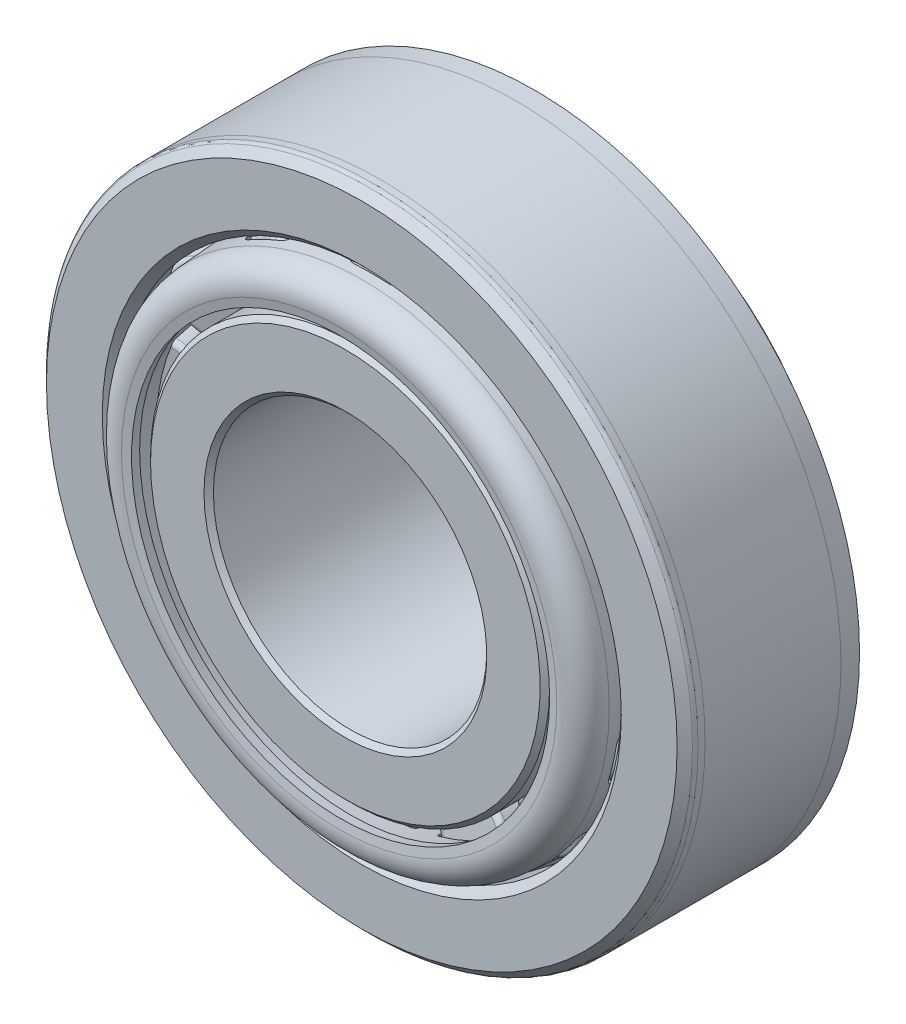
from build123d import *
from OCP.BRepFilletAPI import BRepFilletAPI_MakeChamfer

# Parameters (mm, degrees)
SKETCH8_R                 = 1.405
CUT_EXTRUDE1_DEPTH        = 0.635
FILLET7_R                 = 0.9525
CHAMFER4_SIZE             = 0.35125
CHAMFER4_SIZE2            = 0.341782835
FILLET8_R                 = 0.375
CIRPATTERN1_COUNT         = 14
FILLET9_R                 = 1.765
FILLET10_R                = 0.22425
FILLET11_R                = 0.25
CIRPATTERN2_COUNT         = 14
FILLET11_OF_CIRPATTERN2_R = 0.25
CHAMFER1_SIZE             = 0.648359375
CHAMFER1_SIZE2            = 0.551087377
FILLET6_R                 = 0.389015625
CHAMFER2_SIZE             = 0.3285
CHAMFER3_SIZE             = 0.6095


with BuildPart() as part:
    # Sketch2 → Revolve1 (revolve)
    with BuildSketch(Plane(origin=(0, 0, 0), x_dir=(0, 0, -1), z_dir=(1, 0, 0)), mode=Mode.PRIVATE) as revolve1_sk:
        Polygon((-6.0325, 22.621875), (-6.0325, 17.435), (6.0325, 19.845), (6.0325, 22.621875), align=None)
    revolve(revolve1_sk.sketch.rotate(Axis((0, 0, 0), (0, 0, -1)), 90), axis=Axis((0, 0, 0), (0, 0, -1)))

    # Chamfer1: one chamfer whose edges measure the first distance from different faces: ONE call of the kernel's chamfer builder (chamfer() names one face for all edges)
    chamfer1_edges_1 = [part.edges().sort_by_distance(p)[0] for p in [
        (-17.435, 0, 6.0325),
    ]]
    chamfer1_side_1 = [part.faces().sort_by_distance(p)[0] for p in [
        (-21.982031751, 0, 6.0325),
    ]]
    chamfer1_edges_2 = [part.edges().sort_by_distance(p)[0] for p in [
        (-22.621875, 0, 6.0325),
    ]]
    chamfer1 = BRepFilletAPI_MakeChamfer(part.part.solid().wrapped)
    for e in chamfer1_edges_1:
        chamfer1.Add(CHAMFER1_SIZE, CHAMFER1_SIZE2, e.wrapped, chamfer1_side_1[0].wrapped)  # the first distance lies on this face
    for e in chamfer1_edges_2:
        chamfer1.Add(CHAMFER1_SIZE, e.wrapped)
    add(Compound.cast(chamfer1.Shape()), mode=Mode.REPLACE)

    # Fillet6
    fillet6_edges = [part.edges().sort_by_distance(p)[0] for p in [
        (-22.621875, 0, 5.384140625),
    ]]
    fillet(fillet6_edges, radius=FILLET6_R)


with BuildPart() as body_2:
    # Sketch3 → Revolve2 (revolve)
    with BuildSketch(Plane(origin=(0, 0, 0), x_dir=(0, 0, -1), z_dir=(1, 0, 0)), mode=Mode.PRIVATE) as revolve2_sk:
        Polygon((-7.1755, 13.905), (-7.1755, 9.525), (9.4615, 9.525), (9.4615, 15.62), (6.110238792, 15.62), (6.355886877, 14.180835055), (-4.569023755, 12.630568087), (-4.7865539, 13.905), align=None)
    revolve(revolve2_sk.sketch.rotate(Axis((0, 0, 0), (0, 0, -1)), 90), axis=Axis((0, 0, 0), (0, 0, -1)))

    # Chamfer2
    chamfer2_edges = [body_2.edges().sort_by_distance(p)[0] for p in [
        (-9.525, 0, 7.1755),
        (-13.905, 0, 7.1755),
    ]]
    chamfer(chamfer2_edges, length=CHAMFER2_SIZE)

    # Chamfer3
    chamfer3_edges = [body_2.edges().sort_by_distance(p)[0] for p in [
        (-15.62, 0, -9.4615),
        (-9.525, 0, -9.4615),
    ]]
    chamfer(chamfer3_edges, length=CHAMFER3_SIZE)


with BuildPart() as body_3:
    # Sketch4 → Revolve3 (revolve)
    with BuildSketch(Plane(origin=(0, 0, 0), x_dir=(0, 0, -1), z_dir=(1, 0, 0)), mode=Mode.PRIVATE) as revolve3_sk:
        Polygon((9.2075, 17.771826562), (9.091404373, 18.451989635), (-7.935764393, 17.066643489), (-7.50935656, 14.568471332), (-6.829193487, 14.684566959), (-6.887241301, 15.024648495), align=None)
    revolve(revolve3_sk.sketch.rotate(Axis((0, 0, 0), (0, 0, -1)), 90), axis=Axis((0, 0, 0), (0, 0, -1)))

    # Fillet9
    fillet9_edges = [body_3.edges().sort_by_distance(p)[0] for p in [
        (-17.066643489, 0, 7.935764393),
    ]]
    fillet(fillet9_edges, radius=FILLET9_R)

    # Fillet10
    fillet10_edges = [body_3.edges().sort_by_distance(p)[0] for p in [
        (-18.451989635, 0, -9.091404373),
        (-17.771826562, 0, -9.2075),
    ]]
    fillet(fillet10_edges, radius=FILLET10_R)

    # Sketch9 → Cut-Revolve2 (revolve, cut)
    with BuildSketch(Plane(origin=(0, 0, 0), x_dir=(0, 0, -1), z_dir=(1, 0, 0)), mode=Mode.PRIVATE) as cut_revolve2_sk:
        Polygon((-4.989660083, 15.094927046), (5.883091644, 16.950774525), (6.387447059, 13.99593515), (-4.537463573, 12.445668182), align=None)
    cut_revolve2 = revolve(cut_revolve2_sk.sketch.rotate(Axis((0, 15.094927046, 4.989660083), (0, 0.1682545312254729, -0.9857435836575841)), 180), axis=Axis((0, 15.094927046, 4.989660083), (0, 0.1682545312254729, -0.9857435836575841)), mode=Mode.SUBTRACT)

    # Fillet11
    fillet11_edges = [body_3.edges().sort_by_distance(p)[0] for p in [
        (-2.405641367, 16.276152194, 5.191280958),
        (2.405641367, 16.276152194, 5.191280958),
        (2.953238051, 17.457100574, -5.796667899),
        (-2.953238051, 17.457100574, -5.796667899),
    ]]
    fillet(fillet11_edges, radius=FILLET11_R)

    # CirPattern2: Cut-Revolve2 ×14 about axis
    cirpattern2_axis = Axis((0, 0, 0), (0, 0, 1))
    for i in range(1, CIRPATTERN2_COUNT):
        add(cut_revolve2.rotate(cirpattern2_axis, i * 360 / CIRPATTERN2_COUNT), mode=Mode.SUBTRACT)

    # Fillet11 of CirPattern2
    fillet11_of_cirpattern2_edges = [body_3.edges().sort_by_distance(p)[0] for p in [
        (-9.229365751, 13.620537745, 5.191280958),
        (-4.894549793, 15.708075087, 5.191280958),
        (-4.913576528, 17.009666109, -5.796667899),
        (-10.235127615, 14.446942173, -5.796667899),
        (-14.225101058, 8.26720875, 5.191280958),
        (-11.225315339, 12.028821062, 5.191280958),
        (-11.807197014, 13.193258661, -5.796667899),
        (-15.489824629, 8.575389695, -5.796667899),
        (-16.40338064, 1.276457672, 5.191280958),
        (-15.332769513, 5.967111502, 5.191280958),
        (-16.362257326, 6.763764531, -5.796667899),
        (-17.676571905, 1.005376117, -5.796667899),
        (-15.332769513, -5.967111502, 5.191280958),
        (-16.40338064, -1.276457672, 5.191280958),
        (-17.676571905, -1.005376117, -5.796667899),
        (-16.362257326, -6.763764531, -5.796667899),
        (-11.225315339, -12.028821062, 5.191280958),
        (-14.225101058, -8.26720875, 5.191280958),
        (-15.489824629, -8.575389695, -5.796667899),
        (-11.807197014, -13.193258661, -5.796667899),
        (-4.894549793, -15.708075087, 5.191280958),
        (-9.229365751, -13.620537745, 5.191280958),
        (-10.235127615, -14.446942173, -5.796667899),
        (-4.913576528, -17.009666109, -5.796667899),
        (2.405641367, -16.276152194, 5.191280958),
        (-2.405641367, -16.276152194, 5.191280958),
        (-2.953238051, -17.457100574, -5.796667899),
        (2.953238051, -17.457100574, -5.796667899),
        (9.229365751, -13.620537745, 5.191280958),
        (4.894549793, -15.708075087, 5.191280958),
        (4.913576528, -17.009666109, -5.796667899),
        (10.235127615, -14.446942173, -5.796667899),
        (14.225101058, -8.26720875, 5.191280958),
        (11.225315339, -12.028821062, 5.191280958),
        (11.807197014, -13.193258661, -5.796667899),
        (15.489824629, -8.575389695, -5.796667899),
        (16.40338064, -1.276457672, 5.191280958),
        (15.332769513, -5.967111502, 5.191280958),
        (16.362257326, -6.763764531, -5.796667899),
        (17.676571905, -1.005376117, -5.796667899),
        (15.332769513, 5.967111502, 5.191280958),
        (16.40338064, 1.276457672, 5.191280958),
        (17.676571905, 1.005376117, -5.796667899),
        (16.362257326, 6.763764531, -5.796667899),
        (11.225315339, 12.028821062, 5.191280958),
        (14.225101058, 8.26720875, 5.191280958),
        (15.489824629, 8.575389695, -5.796667899),
        (11.807197014, 13.193258661, -5.796667899),
        (4.894549793, 15.708075087, 5.191280958),
        (9.229365751, 13.620537745, 5.191280958),
        (10.235127615, 14.446942173, -5.796667899),
        (4.913576528, 17.009666109, -5.796667899),
    ]]
    fillet(fillet11_of_cirpattern2_edges, radius=FILLET11_OF_CIRPATTERN2_R)


with BuildPart() as body_4:
    # Sketch6 → Revolve4 (revolve)
    with BuildSketch(Plane(origin=(0, 0, 0), x_dir=(0, 0, -1), z_dir=(1, 0, 0))):
        Polygon((6.355886877, 14.180835055), (5.883091644, 16.950774525), (-4.989660083, 15.094927046), (-4.569023755, 12.630568087), align=None)
    revolve(axis=Axis((0, 15.094927046, 4.989660083), (0, 0.16825453122547218, -0.9857435836575842)))

    # Sketch8 → Cut-Extrude1 (cut)
    with BuildSketch(Plane(origin=(0, 1.455614447, -8.527928434), x_dir=(-1, 0, 0), z_dir=(0, 0.16825453122547224, -0.9857435836575842))):
        with Locations(Location((0, 15.719260399, 0), (0, 0, 90))):
            Circle(SKETCH8_R)
    extrude(amount=-CUT_EXTRUDE1_DEPTH, mode=Mode.SUBTRACT)

    # Fillet7
    # the kernel refuses this fillet: 0.9525 mm, written as the material it adds along each edge
    with BuildSketch(Plane(origin=(0, 16.843932898, -5.257144469), x_dir=(0, 0.9857435836575842, 0.168254531225472), z_dir=(-1, 0, 0))) as fillet7_piece_1:
        with BuildLine():
            CenterArc((0.506974388, 0.9525), FILLET7_R, 270, 70.528779366)
            Line((0.506974388, 0), (0.506974388, -0.01905))
            Line((0.506974388, -0.01905), (1.405, -0.01905))
            Line((1.405, -0.01905), (1.42405, 0))
            ThreePointArc((1.42405, 0), (1.42405, 0.3175), (1.422960512, 0.62865))
            Line((1.422960512, 0.62865), (1.405, 0.635))
        make_face()
    revolve(axis=Axis((0, 16.843932898, -5.257144469), (0, 0.16825453122547224, -0.9857435836575842)))

    # Chamfer4
    chamfer4_edges = [body_4.edges().sort_by_distance(p)[0] for p in [
        (0, 19.720713995, -5.410296412),
    ]]
    chamfer4_side = [body_4.faces().sort_by_distance(p)[0] for p in [
        (0, 19.642368276, -5.42366908),
    ]]
    chamfer(chamfer4_edges, length=CHAMFER4_SIZE, length2=CHAMFER4_SIZE2, reference=chamfer4_side[0])

    # Fillet8
    fillet8_edges = [body_4.edges().sort_by_distance(p)[0] for p in [
        (0, 17.559286005, 5.410296412),
    ]]
    fillet(fillet8_edges, radius=FILLET8_R)


with BuildPart() as cirpattern1_1:
    # CirPattern1: pattern copy
    add(body_4.part.rotate(Axis((0, 0, 0), (0, 0, 1)), 1 * 360 / CIRPATTERN1_COUNT))


with BuildPart() as cirpattern1_2:
    # CirPattern1: pattern copy
    add(body_4.part.rotate(Axis((0, 0, 0), (0, 0, 1)), 2 * 360 / CIRPATTERN1_COUNT))


with BuildPart() as cirpattern1_3:
    # CirPattern1: pattern copy
    add(body_4.part.rotate(Axis((0, 0, 0), (0, 0, 1)), 3 * 360 / CIRPATTERN1_COUNT))


with BuildPart() as cirpattern1_4:
    # CirPattern1: pattern copy
    add(body_4.part.rotate(Axis((0, 0, 0), (0, 0, 1)), 4 * 360 / CIRPATTERN1_COUNT))


with BuildPart() as cirpattern1_5:
    # CirPattern1: pattern copy
    add(body_4.part.rotate(Axis((0, 0, 0), (0, 0, 1)), 5 * 360 / CIRPATTERN1_COUNT))


with BuildPart() as cirpattern1_6:
    # CirPattern1: pattern copy
    add(body_4.part.rotate(Axis((0, 0, 0), (0, 0, 1)), 6 * 360 / CIRPATTERN1_COUNT))


with BuildPart() as cirpattern1_7:
    # CirPattern1: pattern copy
    add(body_4.part.rotate(Axis((0, 0, 0), (0, 0, 1)), 7 * 360 / CIRPATTERN1_COUNT))


with BuildPart() as cirpattern1_8:
    # CirPattern1: pattern copy
    add(body_4.part.rotate(Axis((0, 0, 0), (0, 0, 1)), 8 * 360 / CIRPATTERN1_COUNT))


with BuildPart() as cirpattern1_9:
    # CirPattern1: pattern copy
    add(body_4.part.rotate(Axis((0, 0, 0), (0, 0, 1)), 9 * 360 / CIRPATTERN1_COUNT))


with BuildPart() as cirpattern1_10:
    # CirPattern1: pattern copy
    add(body_4.part.rotate(Axis((0, 0, 0), (0, 0, 1)), 10 * 360 / CIRPATTERN1_COUNT))


with BuildPart() as cirpattern1_11:
    # CirPattern1: pattern copy
    add(body_4.part.rotate(Axis((0, 0, 0), (0, 0, 1)), 11 * 360 / CIRPATTERN1_COUNT))


with BuildPart() as cirpattern1_12:
    # CirPattern1: pattern copy
    add(body_4.part.rotate(Axis((0, 0, 0), (0, 0, 1)), 12 * 360 / CIRPATTERN1_COUNT))


with BuildPart() as cirpattern1_13:
    # CirPattern1: pattern copy
    add(body_4.part.rotate(Axis((0, 0, 0), (0, 0, 1)), 13 * 360 / CIRPATTERN1_COUNT))


solid = Compound([part.part, body_2.part, body_3.part, body_4.part, cirpattern1_1.part, cirpattern1_2.part, cirpattern1_3.part, cirpattern1_4.part, cirpattern1_5.part, cirpattern1_6.part, cirpattern1_7.part, cirpattern1_8.part, cirpattern1_9.part, cirpattern1_10.part, cirpattern1_11.part, cirpattern1_12.part, cirpattern1_13.part])
